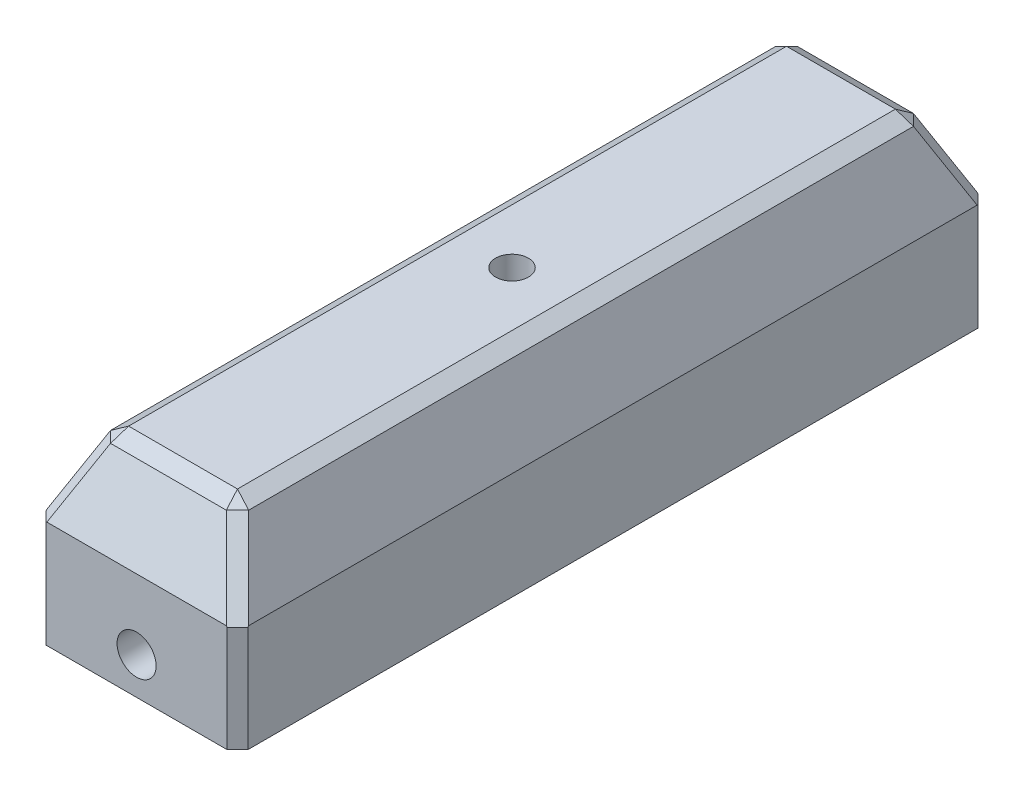
from build123d import *

# Parameters (mm, degrees)
EXTRUDE_1_DEPTH     = 36.5
CUT_EXTRUDE_1_DEPTH = 39.585575484
SKETCH_3_W          = 8.80936978
SKETCH_3_H          = 5.154088086
EXTRUDE_3_DEPTH     = 8.25
SKETCH_4_R          = 0.95
CUT_EXTRUDE_2_DEPTH = 10
SKETCH_5_W          = 4
SKETCH_5_H          = 3.5
SKETCH_6_R          = 0.8
CUT_EXTRUDE_3_DEPTH = 38.904707278


with BuildPart() as part:
    # ｽｹｯﾁ1 → ﾎﾞｽ - 押し出し1 (new body)
    with BuildSketch(Plane.XY):
        Polygon((-3.49531511, 0), (-1.50468489, 0), (-0.99531511, -1.2), (0.99531511, -1.2), (1.50468489, 0), (3.49531511, 0), (4.00468489, -1.2), (4.90468489, -1.2), (4.90468489, 4), (3.146705018, 7.77), (-3.146705018, 7.77), (-4.90468489, 4), (-4.90468489, -1.2), (-4.00468489, -1.2), align=None)
    extrude(amount=EXTRUDE_1_DEPTH)

    # ｽｹｯﾁ2 → ｶｯﾄ - 押し出し1 (cut, through all)
    with BuildSketch(Plane(origin=(4.90468489, 0, 0), x_dir=(0, 0, -1), z_dir=(1, 0, 0))):
        Polygon((-36.5, 4), (-34.742020129, 7.77), (-36.5, 7.77), align=None)
        Polygon((-1.757979871, 7.77), (0, 7.77), (0, 4), align=None)
    extrude(amount=-CUT_EXTRUDE_1_DEPTH, mode=Mode.SUBTRACT)

    # 面取り1
    # the kernel refuses this chamfer: 0.5 mm, written as the material it takes off along each edge
    with BuildSketch(Plane(origin=(-2.939971721, 7.467897404, 1.964713169), x_dir=(0.19590671622030337, 0.5268881046463144, 0.8270486586180961), z_dir=(-0.41632572739388213, 0.8082980746110389, -0.4163257273938791)), Plane(origin=(2.939971721, 7.467897404, 1.964713169), x_dir=(-0.8270486586180947, 0.5268881046463163, 0.1959067162203037), z_dir=(0.4163257273938816, 0.8082980746110384, -0.41632572739388035))) as chamfer_1_piece_1:
        Polygon((-0.400884159, 0.228990916), (0.459173014, 0.228990916), (-0.058288855, -0.457981831), align=None)
    extrude(amount=0.4579583, mode=Mode.SUBTRACT)
    with BuildSketch(Plane(origin=(-2.939971721, 7.467897404, 34.535286831), x_dir=(-0.1959067162203061, -0.5268881046463181, 0.827048658618093), z_dir=(-0.4163257273938827, 0.8082980746110371, 0.4163257273938816))) as chamfer_1_piece_2:
        Polygon((-0.459173014, 0.228990916), (0.400884159, 0.228990916), (0.058288855, -0.457981831), align=None)
    extrude(amount=0.4579583, mode=Mode.SUBTRACT)
    with BuildSketch(Plane(origin=(2.939971721, 7.467897404, 34.535286831), x_dir=(-0.8270486586180942, 0.5268881046463159, -0.19590671622030717), z_dir=(0.41632572739387785, 0.8082980746110375, 0.41632572739388596))) as chamfer_1_piece_3:
        Polygon((-0.400884159, -0.228990916), (0.459173014, -0.228990916), (-0.058288855, 0.457981831), align=None)
    extrude(amount=0.4579583, mode=Mode.SUBTRACT)
    with BuildSketch(Plane(origin=(4.90468489, -2.485841494, 36.5), x_dir=(-0.999621916911297, 0, 0.0274958766105822), z_dir=(0, 1, 0)), Plane(origin=(-4.90468489, 5.285841494, 36.5), x_dir=(0.999621916911297, 0, 0.0274958766105822), z_dir=(0, -1, 0))) as chamfer_1_piece_4:
        with BuildLine():
            Line((0.514336598, 0), (-0.028273577, -0.513558897))
            Line((-0.028273577, -0.513558897), (-0.038269797, -0.513283938))
            ThreePointArc((-0.038269797, -0.513283938), (-0.017064614, -0.256698915), (-0.009996219, 0.000274959))
            Line((-0.009996219, 0.000274959), (0.000274959, 0.009996219))
            ThreePointArc((0.000274959, 0.009996219), (0.257248832, 0.002927825), (0.514611556, 0.009996219))
            Line((0.514611556, 0.009996219), (0.514336598, 0))
        make_face()
    extrude(amount=7.771682988, mode=Mode.SUBTRACT)
    with BuildSketch(Plane(origin=(-4.90468489, 5.285841494, 0), x_dir=(0.9996219169112968, 0, -0.02749587661058639), z_dir=(0, -1, 0)), Plane(origin=(4.90468489, -2.485841494, 0), x_dir=(-0.9996219169112968, 0, -0.02749587661058639), z_dir=(0, 1, 0))) as chamfer_1_piece_5:
        with BuildLine():
            Line((0.514336598, 0), (-0.028273577, 0.513558897))
            Line((-0.028273577, 0.513558897), (-0.038269797, 0.513283938))
            ThreePointArc((-0.038269797, 0.513283938), (-0.017064614, 0.256698915), (-0.009996219, -0.000274959))
            Line((-0.009996219, -0.000274959), (0.000274959, -0.009996219))
            ThreePointArc((0.000274959, -0.009996219), (0.257248832, -0.002927825), (0.514611556, -0.009996219))
            Line((0.514611556, -0.009996219), (0.514336598, 0))
        make_face()
    extrude(amount=7.771682988, mode=Mode.SUBTRACT)
    with BuildSketch(Plane(origin=(-3.146705018, 7.77, 0.46553106), x_dir=(-0.4413655645980938, -0.8973273864019787, 0), z_dir=(0, 0, 1))) as chamfer_1_piece_6:
        with BuildLine():
            Line((0.516979525, 0), (-0.237770334, 0.459056747))
            Line((-0.237770334, 0.459056747), (-0.246743608, 0.454643091))
            ThreePointArc((-0.246743608, 0.454643091), (-0.123037104, 0.227486173), (-0.008973274, -0.004413656))
            Line((-0.008973274, -0.004413656), (0.000207861, -0.009997839))
            ThreePointArc((0.000207861, -0.009997839), (0.25858594, -0.004626004), (0.517187386, -0.009997839))
            Line((0.517187386, -0.009997839), (0.516979525, 0))
        make_face()
    extrude(amount=35.568937881, mode=Mode.SUBTRACT)
    with BuildSketch(Plane(origin=(3.146705018, 7.77, 0.46553106), x_dir=(0.4413655645980931, -0.8973273864019791, 0), z_dir=(0, 0, 1))) as chamfer_1_piece_7:
        with BuildLine():
            Line((0.516979525, 0), (-0.237770334, -0.459056747))
            Line((-0.237770334, -0.459056747), (-0.246743608, -0.454643091))
            ThreePointArc((-0.246743608, -0.454643091), (-0.123037104, -0.227486173), (-0.008973274, 0.004413656))
            Line((-0.008973274, 0.004413656), (0.000207861, 0.009997839))
            ThreePointArc((0.000207861, 0.009997839), (0.25858594, 0.004626004), (0.517187386, 0.009997839))
            Line((0.517187386, 0.009997839), (0.516979525, 0))
        make_face()
    extrude(amount=35.568937881, mode=Mode.SUBTRACT)
    with BuildSketch(Plane(origin=(4.43915383, 7.77, 34.742020129), x_dir=(0, -0.8973273864019841, 0.4413655645980827), z_dir=(-1, 0, 0))) as chamfer_1_piece_8:
        with BuildLine():
            Line((0.516979525, 0), (-0.237770334, -0.459056747))
            Line((-0.237770334, -0.459056747), (-0.246743608, -0.454643091))
            ThreePointArc((-0.246743608, -0.454643091), (-0.123037104, -0.227486173), (-0.008973274, 0.004413656))
            Line((-0.008973274, 0.004413656), (0.000207861, 0.009997839))
            ThreePointArc((0.000207861, 0.009997839), (0.25858594, 0.004626004), (0.517187386, 0.009997839))
            Line((0.517187386, 0.009997839), (0.516979525, 0))
        make_face()
    extrude(amount=8.87830766, mode=Mode.SUBTRACT)
    with BuildSketch(Plane(origin=(2.645006091, 8.845896822, 34.240321201), x_dir=(-0.9208340423276122, -0.3421923931836881, 0.1870000869994703), z_dir=(0.38928162063502675, -0.8348171294789896, 0.3892816206350195)), Plane(origin=(-5.406383817, 2.924103178, 37.001698928), x_dir=(0.9208340423276125, -0.34219239318369504, 0.18700008699945572), z_dir=(0.38928162063502675, 0.8348171294789896, -0.3892816206350195))) as chamfer_1_piece_9:
        with BuildLine():
            Line((0.515512576, 0), (-0.117174183, 0.502019349))
            Line((-0.117174183, 0.502019349), (-0.126965941, 0.499989208))
            ThreePointArc((-0.126965941, 0.499989208), (-0.062103739, 0.250280562), (-0.009791758, -0.002030141))
            Line((-0.009791758, -0.002030141), (0.000248629, -0.009996909))
            ThreePointArc((0.000248629, -0.009996909), (0.257845581, -0.003590326), (0.515761205, -0.009996909))
            Line((0.515761205, -0.009996909), (0.515512576, 0))
        make_face()
    extrude(amount=7.093521964, mode=Mode.SUBTRACT)
    with BuildSketch(Plane(origin=(2.645006091, 8.845896822, 2.259678799), x_dir=(-0.9208340423276122, -0.3421923931836898, -0.18700008699946685), z_dir=(0.3892816206350268, -0.8348171294789898, -0.3892816206350187)), Plane(origin=(-5.406383817, 2.924103178, -0.501698928), x_dir=(0.9208340423276122, -0.34219239318368977, -0.1870000869994671), z_dir=(0.3892816206350268, 0.8348171294789898, 0.3892816206350187))) as chamfer_1_piece_10:
        with BuildLine():
            Line((0.515512576, 0), (-0.117174183, -0.502019349))
            Line((-0.117174183, -0.502019349), (-0.126965941, -0.499989208))
            ThreePointArc((-0.126965941, -0.499989208), (-0.062103739, -0.250280562), (-0.009791758, 0.002030141))
            Line((-0.009791758, 0.002030141), (0.000248629, 0.009996909))
            ThreePointArc((0.000248629, 0.009996909), (0.257845581, 0.003590326), (0.515761205, 0.009996909))
            Line((0.515761205, 0.009996909), (0.515512576, 0))
        make_face()
    extrude(amount=7.093521964, mode=Mode.SUBTRACT)
    with BuildSketch(Plane(origin=(4.43915383, 7.77, 1.757979871), x_dir=(0, -0.8973273864019825, -0.4413655645980858), z_dir=(-1, 0, 0))) as chamfer_1_piece_11:
        with BuildLine():
            Line((0.516979525, 0), (-0.237770334, 0.459056747))
            Line((-0.237770334, 0.459056747), (-0.246743608, 0.454643091))
            ThreePointArc((-0.246743608, 0.454643091), (-0.123037104, 0.227486173), (-0.008973274, -0.004413656))
            Line((-0.008973274, -0.004413656), (0.000207861, -0.009997839))
            ThreePointArc((0.000207861, -0.009997839), (0.25858594, -0.004626004), (0.517187386, -0.009997839))
            Line((0.517187386, -0.009997839), (0.516979525, 0))
        make_face()
    extrude(amount=8.87830766, mode=Mode.SUBTRACT)

    # ｽｹｯﾁ3 → ﾎﾞｽ - 押し出し3 (add)
    with BuildSketch(Plane.XY.offset(36.5)):
        with Locations((0, 1.377044043)):
            Rectangle(SKETCH_3_W, SKETCH_3_H)
    extrude_3 = extrude(amount=-EXTRUDE_3_DEPTH)

    # ｽｹｯﾁ4 → ｶｯﾄ - 押し出し2 (cut)
    with BuildSketch(Plane.XY.offset(36.5)):
        with Locations((0, 0.6)):
            Circle(SKETCH_4_R)
    cut_extrude_2 = extrude(amount=-CUT_EXTRUDE_2_DEPTH, mode=Mode.SUBTRACT)

    # ﾐﾗｰ1: ﾎﾞｽ - 押し出し3, ｶｯﾄ - 押し出し2 across plane
    add(extrude_3.mirror(Plane(origin=(0, 0, 18.25), x_dir=(1, 0, 0), z_dir=(0, 0, -1))))
    add(cut_extrude_2.mirror(Plane(origin=(0, 0, 18.25), x_dir=(1, 0, 0), z_dir=(0, 0, -1))), mode=Mode.SUBTRACT)

    # ｽｹｯﾁ5 → ｶｯﾄ - 回転1 (revolve, cut)
    with BuildSketch(Plane(origin=(0, 0.6, 0), x_dir=(1, 0, 0), z_dir=(0, 1, 0))):
        with Locations((2, -33.25)):
            Rectangle(SKETCH_5_W, SKETCH_5_H)
        with Locations((2, -3.25)):
            Rectangle(SKETCH_5_W, SKETCH_5_H)
    revolve(axis=Axis((0, 0.6, 26.5), (0, 0, 1)), mode=Mode.SUBTRACT)

    # ｽｹｯﾁ6 → ｶｯﾄ - 押し出し3 (cut, through all)
    with BuildSketch(Plane(origin=(0, 7.77, 0), x_dir=(1, 0, 0), z_dir=(0, 1, 0))):
        with Locations(Location((0, -18.25, 0), (0, 0, 270))):
            Circle(SKETCH_6_R)
    extrude(amount=-CUT_EXTRUDE_3_DEPTH, mode=Mode.SUBTRACT)


solid = part.part
